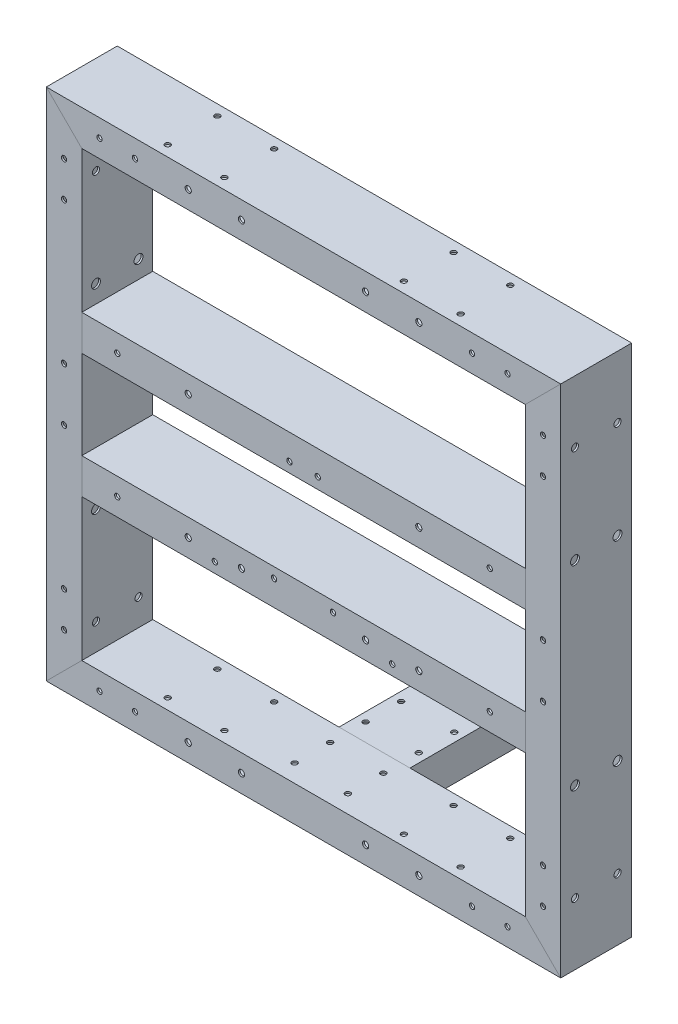
from build123d import *

# Parameters (mm, degrees)
F_20X40X1_LVGUAN20X40_1_DEPTH      = 293.360679775
F_20X40X1_LVGUAN20X40_1_DEPTH_BACK = 23.360679775
SKETCH_11_W                        = 40
SKETCH_11_H                        = 20
SKETCH_11_W_2                      = 38
SKETCH_11_H_2                      = 18
SKETCH_11_ON_SEGMENT_2_W           = 40
SKETCH_11_ON_SEGMENT_2_H           = 20
SKETCH_11_ON_SEGMENT_2_W_2         = 38
SKETCH_11_ON_SEGMENT_2_H_2         = 18
F_20X40X1_LVGUAN20X40_1_2_DEPTH    = 316.72135955
SKETCH_11_ON_SEGMENT_3_W           = 40
SKETCH_11_ON_SEGMENT_3_H           = 20
SKETCH_11_ON_SEGMENT_3_W_2         = 38
SKETCH_11_ON_SEGMENT_3_H_2         = 18
F_20X40X1_LVGUAN20X40_1_3_DEPTH    = 316.72135955
SKETCH_11_ON_SEGMENT_4_W           = 40
SKETCH_11_ON_SEGMENT_4_H           = 20
SKETCH_11_ON_SEGMENT_4_W_2         = 38
SKETCH_11_ON_SEGMENT_4_H_2         = 18
F_20X40X1_LVGUAN20X40_1_4_DEPTH    = 316.72135955
SKETCH_11_ON_SEGMENT_5_W           = 40
SKETCH_11_ON_SEGMENT_5_H           = 20
SKETCH_11_ON_SEGMENT_5_W_2         = 38
SKETCH_11_ON_SEGMENT_5_H_2         = 18
F_20X40X1_LVGUAN20X40_1_5_DEPTH    = 272
SKETCH_11_ON_SEGMENT_6_W           = 40
SKETCH_11_ON_SEGMENT_6_H           = 20
SKETCH_11_ON_SEGMENT_6_W_2         = 38
SKETCH_11_ON_SEGMENT_6_H_2         = 18
F_20X40X1_LVGUAN20X40_1_6_DEPTH    = 272
SKETCH_12_R                        = 2
CUT_EXTRUDE_1_DEPTH                = 318
SKETCH_14_R                        = 1.5
CUT_EXTRUDE_3_DEPTH                = 318
SKETCH_16_R                        = 1.5
CUT_EXTRUDE_5_DEPTH                = 50
SKETCH_113_R                       = 1.5
CUT_EXTRUDE_7_DEPTH                = 20
SKETCH_114_R                       = 1.5
CUT_EXTRUDE_8_DEPTH                = 29
SKETCH_17_R                        = 2.5
CUT_EXTRUDE_12_DEPTH               = 357
SKETCH_119_W                       = 20
SKETCH_119_H                       = 20
SKETCH_119_W_2                     = 18
SKETCH_119_H_2                     = 18
F_20X20X1_LVGUAN20X20_2_DEPTH      = 90
SKETCH_120_R                       = 1.5
CUT_EXTRUDE_13_DEPTH               = 30
SKETCH_121_R                       = 1.75
CUT_EXTRUDE_14_DEPTH               = 100
SKETCH_122_R                       = 1.75
CUT_EXTRUDE_15_DEPTH               = 40
SKETCH_123_R                       = 1.5
CUT_EXTRUDE_16_DEPTH               = 40
SKETCH_125_R                       = 1.5
CUT_EXTRUDE_18_DEPTH               = 40
SKETCH_126_R                       = 1.5
CUT_EXTRUDE_19_DEPTH               = 40
SKETCH_130_W                       = 20
SKETCH_130_H                       = 20
SKETCH_130_W_2                     = 18
SKETCH_130_H_2                     = 18
CUT_EXTRUDE_21_DEPTH               = 100
SKETCH_131_W                       = 40
SKETCH_131_H                       = 20
SKETCH_131_W_2                     = 38
SKETCH_131_H_2                     = 18
F_20X40X1_LVGUAN20X40_3_DEPTH      = 90
SKETCH_132_R                       = 1.5
CUT_EXTRUDE_22_DEPTH               = 100
SKETCH_133_R                       = 1.5
CUT_EXTRUDE_23_DEPTH               = 35
SKETCH_134_R                       = 1.75
CUT_EXTRUDE_24_DEPTH               = 82


with BuildPart() as part:
    # 草图11 → 20x40x1 LVGUAN20X40(1) (new, two sides: drawn at the far end of the back side and taken through both)
    with BuildSketch(Plane.ZX.offset(-270).offset(-F_20X40X1_LVGUAN20X40_1_DEPTH_BACK)):
        Rectangle(SKETCH_11_W, SKETCH_11_H)
        Rectangle(SKETCH_11_W_2, SKETCH_11_H_2, mode=Mode.SUBTRACT)
    extrude(amount=F_20X40X1_LVGUAN20X40_1_DEPTH + F_20X40X1_LVGUAN20X40_1_DEPTH_BACK)

    # 20x40x1 LVGUAN20X40(1) mitre 1
    split(bisect_by=Plane(origin=(0, -270, 0), x_dir=(-0.707106781, -0.707106781, 0), z_dir=(-0.707106781, 0.707106781, 0)), keep=Keep.TOP)

    # 20x40x1 LVGUAN20X40(1) mitre 2
    split(bisect_by=Plane(origin=(0, 0, 0), x_dir=(0.707106781, -0.707106781, 0), z_dir=(-0.707106781, -0.707106781, 0)), keep=Keep.TOP)


with BuildPart() as body_2:
    # 草图11 on segment 2 (carried to segment 2) → 20x40x1 LVGUAN20X40_1 2 (new body)
    with BuildSketch(Plane(origin=(-23.360679775, 0, 0), x_dir=(0, 0, 1), z_dir=(1, 0, 0))):
        Rectangle(SKETCH_11_ON_SEGMENT_2_W, SKETCH_11_ON_SEGMENT_2_H)
        Rectangle(SKETCH_11_ON_SEGMENT_2_W_2, SKETCH_11_ON_SEGMENT_2_H_2, mode=Mode.SUBTRACT)
    extrude(amount=F_20X40X1_LVGUAN20X40_1_2_DEPTH)

    # 20x40x1 LVGUAN20X40_1 2 mitre 1
    split(bisect_by=Plane(origin=(0, 0, 0), x_dir=(-0.707106781, 0.707106781, 0), z_dir=(0.707106781, 0.707106781, 0)), keep=Keep.TOP)

    # 20x40x1 LVGUAN20X40_1 2 mitre 2
    split(bisect_by=Plane(origin=(270, 0, 0), x_dir=(-0.707106781, -0.707106781, 0), z_dir=(-0.707106781, 0.707106781, 0)), keep=Keep.TOP)

    # 草图113 → 切除-拉伸7 (cut)
    with BuildSketch(Plane(origin=(0, 10, 0), x_dir=(1, 0, 0), z_dir=(0, 1, 0))):
        with Locations(Location((217.6, 14, 0), (0, 0, 270))):
            Circle(SKETCH_113_R)
        with Locations(Location((217.6, -14, 0), (0, 0, 270))):
            Circle(SKETCH_113_R)
        with Locations(Location((185.6, -14, 0), (0, 0, 270))):
            Circle(SKETCH_113_R)
        with Locations(Location((185.6, 14, 0), (0, 0, 270))):
            Circle(SKETCH_113_R)
        with Locations(Location((84.4, -14, 0), (0, 0, 270))):
            Circle(SKETCH_113_R)
        with Locations(Location((52.4, -14, 0), (0, 0, 270))):
            Circle(SKETCH_113_R)
        with Locations(Location((52.4, 14, 0), (0, 0, 270))):
            Circle(SKETCH_113_R)
        with Locations(Location((84.4, 14, 0), (0, 0, 270))):
            Circle(SKETCH_113_R)
    extrude(amount=-CUT_EXTRUDE_7_DEPTH, mode=Mode.SUBTRACT)


with BuildPart() as body_3:
    # 草图11 on segment 3 (carried to segment 3) → 20x40x1 LVGUAN20X40_1 3 (new body)
    with BuildSketch(Plane(origin=(270, 23.360679775, 0), x_dir=(0, 0, 1), z_dir=(0, -1, 0))):
        Rectangle(SKETCH_11_ON_SEGMENT_3_W, SKETCH_11_ON_SEGMENT_3_H)
        Rectangle(SKETCH_11_ON_SEGMENT_3_W_2, SKETCH_11_ON_SEGMENT_3_H_2, mode=Mode.SUBTRACT)
    extrude(amount=F_20X40X1_LVGUAN20X40_1_3_DEPTH)

    # 20x40x1 LVGUAN20X40_1 3 mitre 1
    split(bisect_by=Plane(origin=(270, 0, 0), x_dir=(0.707106781, 0.707106781, 0), z_dir=(0.707106781, -0.707106781, 0)), keep=Keep.TOP)

    # 20x40x1 LVGUAN20X40_1 3 mitre 2
    split(bisect_by=Plane(origin=(270, -270, 0), x_dir=(-0.707106781, 0.707106781, 0), z_dir=(0.707106781, 0.707106781, 0)), keep=Keep.TOP)


with BuildPart() as body_4:
    # 草图11 on segment 4 (carried to segment 4) → 20x40x1 LVGUAN20X40_1 4 (new body)
    with BuildSketch(Plane(origin=(293.360679775, -270, 0), x_dir=(0, 0, 1), z_dir=(-1, 0, 0))):
        Rectangle(SKETCH_11_ON_SEGMENT_4_W, SKETCH_11_ON_SEGMENT_4_H)
        Rectangle(SKETCH_11_ON_SEGMENT_4_W_2, SKETCH_11_ON_SEGMENT_4_H_2, mode=Mode.SUBTRACT)
    extrude(amount=F_20X40X1_LVGUAN20X40_1_4_DEPTH)

    # 20x40x1 LVGUAN20X40_1 4 mitre 1
    split(bisect_by=Plane(origin=(270, -270, 0), x_dir=(0.707106781, -0.707106781, 0), z_dir=(-0.707106781, -0.707106781, 0)), keep=Keep.TOP)

    # 20x40x1 LVGUAN20X40_1 4 mitre 2
    split(bisect_by=Plane(origin=(0, -270, 0), x_dir=(0.707106781, 0.707106781, 0), z_dir=(0.707106781, -0.707106781, 0)), keep=Keep.TOP)

    # 草图114 → 切除-拉伸8 (cut)
    with BuildSketch(Plane.XZ.offset(280)):
        with Locations(Location((185.6, -14, 0), (0, 0, 270))):
            Circle(SKETCH_114_R)
        with Locations(Location((217.6, -14, 0), (0, 0, 270))):
            Circle(SKETCH_114_R)
        with Locations(Location((217.6, 14, 0), (0, 0, 270))):
            Circle(SKETCH_114_R)
        with Locations(Location((185.6, 14, 0), (0, 0, 270))):
            Circle(SKETCH_114_R)
        with Locations(Location((52.4, 14, 0), (0, 0, 270))):
            Circle(SKETCH_114_R)
        with Locations(Location((52.4, -14, 0), (0, 0, 270))):
            Circle(SKETCH_114_R)
        with Locations(Location((84.4, -14, 0), (0, 0, 270))):
            Circle(SKETCH_114_R)
        with Locations(Location((84.4, 14, 0), (0, 0, 270))):
            Circle(SKETCH_114_R)
    extrude(amount=-CUT_EXTRUDE_8_DEPTH, mode=Mode.SUBTRACT)


with BuildPart() as body_5:
    # 草图11 on segment 5 (carried to segment 5) → 20x40x1 LVGUAN20X40_1 5 (new body)
    with BuildSketch(Plane(origin=(-1, -100, 0), x_dir=(0, 0, 1), z_dir=(1, 0, 0))):
        Rectangle(SKETCH_11_ON_SEGMENT_5_W, SKETCH_11_ON_SEGMENT_5_H)
        Rectangle(SKETCH_11_ON_SEGMENT_5_W_2, SKETCH_11_ON_SEGMENT_5_H_2, mode=Mode.SUBTRACT)
    extrude(amount=F_20X40X1_LVGUAN20X40_1_5_DEPTH)

    # 20x40x1 LVGUAN20X40_1 5 mitre 1
    split(bisect_by=Plane(origin=(10, -100, 0), x_dir=(0, 1, 0), z_dir=(1, 0, 0)), keep=Keep.TOP)

    # 20x40x1 LVGUAN20X40_1 5 mitre 2
    split(bisect_by=Plane(origin=(260, -100, 0), x_dir=(0, -1, 0), z_dir=(-1, 0, 0)), keep=Keep.TOP)

    # 草图16 → 切除-拉伸5 (cut)
    with BuildSketch(Plane.XY.offset(20)):
        with Locations(Location((127.046945119, -104.34720003, 0), (0, 0, 270))):
            Circle(SKETCH_16_R)
        with Locations(Location((143.036845279, -103.77878744, 0), (0, 0, 270))):
            Circle(SKETCH_16_R)
    extrude(amount=-CUT_EXTRUDE_5_DEPTH, mode=Mode.SUBTRACT)


with BuildPart() as body_6:
    # 草图11 on segment 6 (carried to segment 6) → 20x40x1 LVGUAN20X40_1 6 (new body)
    with BuildSketch(Plane(origin=(-1, -170, 0), x_dir=(0, 0, 1), z_dir=(1, 0, 0))):
        Rectangle(SKETCH_11_ON_SEGMENT_6_W, SKETCH_11_ON_SEGMENT_6_H)
        Rectangle(SKETCH_11_ON_SEGMENT_6_W_2, SKETCH_11_ON_SEGMENT_6_H_2, mode=Mode.SUBTRACT)
    extrude(amount=F_20X40X1_LVGUAN20X40_1_6_DEPTH)

    # 20x40x1 LVGUAN20X40_1 6 mitre 1
    split(bisect_by=Plane(origin=(10, -170, 0), x_dir=(0, 1, 0), z_dir=(1, 0, 0)), keep=Keep.TOP)

    # 20x40x1 LVGUAN20X40_1 6 mitre 2
    split(bisect_by=Plane(origin=(260, -170, 0), x_dir=(0, -1, 0), z_dir=(-1, 0, 0)), keep=Keep.TOP)

    # 草图14 → 切除-拉伸3 (cut)
    with BuildSketch(Plane.XY.offset(20)):
        with Locations((85, -174.25)):
            Circle(SKETCH_14_R)
        with Locations((185, -174.25)):
            Circle(SKETCH_14_R)
        with Locations((118.4, -165.75)):
            Circle(SKETCH_14_R)
        with Locations((151.6, -165.75)):
            Circle(SKETCH_14_R)
    extrude(amount=-CUT_EXTRUDE_3_DEPTH, mode=Mode.SUBTRACT)


with BuildPart() as cut_extrude_1_tool:
    # 草图12 → 切除-拉伸1 (new body)
    with BuildSketch(Plane.ZY.offset(10)):
        with Locations((-12, -25)):
            Circle(SKETCH_12_R)
        with Locations((12, -25)):
            Circle(SKETCH_12_R)
        with Locations((-12, -245)):
            Circle(SKETCH_12_R)
        with Locations((12, -245)):
            Circle(SKETCH_12_R)
    extrude(amount=-CUT_EXTRUDE_1_DEPTH)


with BuildPart() as part_1:
    add(part.part)

    # 切除-拉伸1: cut by cut_extrude_1_tool
    add(cut_extrude_1_tool.part, mode=Mode.SUBTRACT)


with BuildPart() as body_3_1:
    add(body_3.part)

    # 切除-拉伸1: cut by cut_extrude_1_tool
    add(cut_extrude_1_tool.part, mode=Mode.SUBTRACT)


with BuildPart() as cut_extrude_12_tool:
    # 草图17 → 切除-拉伸12 (new body)
    with BuildSketch(Plane(origin=(280, 0, 0), x_dir=(0, 0, -1), z_dir=(1, 0, 0))):
        with Locations((-12, -80)):
            Circle(SKETCH_17_R)
        with Locations((12, -80)):
            Circle(SKETCH_17_R)
        with Locations((-12, -190)):
            Circle(SKETCH_17_R)
        with Locations((12, -190)):
            Circle(SKETCH_17_R)
    extrude(amount=-CUT_EXTRUDE_12_DEPTH)


with BuildPart() as part_2:
    add(part_1.part)

    # 切除-拉伸12: cut by cut_extrude_12_tool
    add(cut_extrude_12_tool.part, mode=Mode.SUBTRACT)


with BuildPart() as body_3_2:
    add(body_3_1.part)

    # 切除-拉伸12: cut by cut_extrude_12_tool
    add(cut_extrude_12_tool.part, mode=Mode.SUBTRACT)


with BuildPart() as body_7:
    # 草图119 → 20x20x1 LVGUAN20X20(2) (new body)
    with BuildSketch(Plane(origin=(135, -270, -20), x_dir=(1, 0, 0), z_dir=(0, 0, -1))):
        Rectangle(SKETCH_119_W, SKETCH_119_H)
        Rectangle(SKETCH_119_W_2, SKETCH_119_H_2, mode=Mode.SUBTRACT)
    extrude(amount=F_20X20X1_LVGUAN20X20_2_DEPTH)

    # 草图120 → 切除-拉伸13 (cut)
    with BuildSketch(Plane(origin=(0, -260, 0), x_dir=(1, 0, 0), z_dir=(0, 1, 0))):
        with Locations(Location((129, 105, 0), (0, 0, 270))):
            Circle(SKETCH_120_R)
        with Locations(Location((141, 105, 0), (0, 0, 270))):
            Circle(SKETCH_120_R)
        with Locations(Location((141, 85, 0), (0, 0, 270))):
            Circle(SKETCH_120_R)
        with Locations(Location((129, 85, 0), (0, 0, 270))):
            Circle(SKETCH_120_R)
    extrude(amount=-CUT_EXTRUDE_13_DEPTH, mode=Mode.SUBTRACT)

    # 草图130 → 切除-拉伸21 (cut)
    with BuildSketch(Plane(origin=(0, 0, -20), x_dir=(-1, 0, 0), z_dir=(0, 0, -1))):
        with Locations((-135, -270)):
            Rectangle(SKETCH_130_W, SKETCH_130_H)
        with Locations((-135, -270)):
            Rectangle(SKETCH_130_W_2, SKETCH_130_H_2, mode=Mode.SUBTRACT)
    extrude(amount=CUT_EXTRUDE_21_DEPTH, mode=Mode.SUBTRACT)


with BuildPart() as cut_extrude_14_tool:
    # 草图121 → 切除-拉伸14 (new body)
    with BuildSketch(Plane.XY.offset(20)):
        with Locations((170, -270)):
            Circle(SKETCH_121_R)
        with Locations((100, -270)):
            Circle(SKETCH_121_R)
        with Locations((100, -170)):
            Circle(SKETCH_121_R)
        with Locations((170, -170)):
            Circle(SKETCH_121_R)
        with Locations((200, -170)):
            Circle(SKETCH_121_R)
        with Locations((70, -170)):
            Circle(SKETCH_121_R)
        with Locations((70, -270)):
            Circle(SKETCH_121_R)
        with Locations((200, -270)):
            Circle(SKETCH_121_R)
    extrude(amount=-CUT_EXTRUDE_14_DEPTH)


with BuildPart() as body_4_1:
    add(body_4.part)

    # 切除-拉伸14: cut by cut_extrude_14_tool
    add(cut_extrude_14_tool.part, mode=Mode.SUBTRACT)


with BuildPart() as body_6_1:
    add(body_6.part)

    # 切除-拉伸14: cut by cut_extrude_14_tool
    add(cut_extrude_14_tool.part, mode=Mode.SUBTRACT)


with BuildPart() as cut_extrude_15_tool:
    # 草图122 → 切除-拉伸15 (new body)
    with BuildSketch(Plane(origin=(0, 0, -20), x_dir=(-1, 0, 0), z_dir=(0, 0, -1))):
        with Locations(Location((-200, -100, 0), (0, 0, 90))):
            Circle(SKETCH_122_R)
        with Locations(Location((-70, -100, 0), (0, 0, 90))):
            Circle(SKETCH_122_R)
        with Locations(Location((-70, 0, 0), (0, 0, 90))):
            Circle(SKETCH_122_R)
        with Locations(Location((-200, 0, 0), (0, 0, 90))):
            Circle(SKETCH_122_R)
    extrude(amount=-CUT_EXTRUDE_15_DEPTH)


with BuildPart() as body_2_1:
    add(body_2.part)

    # 切除-拉伸15: cut by cut_extrude_15_tool
    add(cut_extrude_15_tool.part, mode=Mode.SUBTRACT)


with BuildPart() as body_5_1:
    add(body_5.part)

    # 切除-拉伸15: cut by cut_extrude_15_tool
    add(cut_extrude_15_tool.part, mode=Mode.SUBTRACT)


with BuildPart() as cut_extrude_16_tool:
    # 草图123 → 切除-拉伸16 (new body)
    with BuildSketch(Plane(origin=(0, 0, -20), x_dir=(-1, 0, 0), z_dir=(0, 0, -1))):
        with Locations(Location((-240, -100, 0), (0, 0, 90))):
            Circle(SKETCH_123_R)
        with Locations(Location((-240, -170, 0), (0, 0, 90))):
            Circle(SKETCH_123_R)
        with Locations(Location((-30, -100, 0), (0, 0, 90))):
            Circle(SKETCH_123_R)
        with Locations(Location((-30, -170, 0), (0, 0, 90))):
            Circle(SKETCH_123_R)
    extrude(amount=-CUT_EXTRUDE_16_DEPTH)


with BuildPart() as body_5_2:
    add(body_5_1.part)

    # 切除-拉伸16: cut by cut_extrude_16_tool
    add(cut_extrude_16_tool.part, mode=Mode.SUBTRACT)


with BuildPart() as body_6_2:
    add(body_6_1.part)

    # 切除-拉伸16: cut by cut_extrude_16_tool
    add(cut_extrude_16_tool.part, mode=Mode.SUBTRACT)


with BuildPart() as cut_extrude_18_tool:
    # 草图125 → 切除-拉伸18 (new body)
    with BuildSketch(Plane(origin=(0, 0, -20), x_dir=(-1, 0, 0), z_dir=(0, 0, -1))):
        with Locations(Location((-40, -270, 0), (0, 0, 90))):
            Circle(SKETCH_125_R)
        with Locations(Location((-20, -270, 0), (0, 0, 90))):
            Circle(SKETCH_125_R)
        with Locations(Location((0, -230, 0), (0, 0, 90))):
            Circle(SKETCH_125_R)
        with Locations(Location((0, -250, 0), (0, 0, 90))):
            Circle(SKETCH_125_R)
        with Locations(Location((-270, -230, 0), (0, 0, 90))):
            Circle(SKETCH_125_R)
        with Locations(Location((-270, -250, 0), (0, 0, 90))):
            Circle(SKETCH_125_R)
        with Locations(Location((-230, -270, 0), (0, 0, 90))):
            Circle(SKETCH_125_R)
        with Locations(Location((-250, -270, 0), (0, 0, 90))):
            Circle(SKETCH_125_R)
        with Locations(Location((0, -40, 0), (0, 0, 90))):
            Circle(SKETCH_125_R)
        with Locations(Location((0, -20, 0), (0, 0, 90))):
            Circle(SKETCH_125_R)
        with Locations(Location((-40, 0, 0), (0, 0, 90))):
            Circle(SKETCH_125_R)
        with Locations(Location((-20, 0, 0), (0, 0, 90))):
            Circle(SKETCH_125_R)
        with Locations(Location((-230, 0, 0), (0, 0, 90))):
            Circle(SKETCH_125_R)
        with Locations(Location((-250, 0, 0), (0, 0, 90))):
            Circle(SKETCH_125_R)
        with Locations(Location((-270, -40, 0), (0, 0, 90))):
            Circle(SKETCH_125_R)
        with Locations(Location((-270, -20, 0), (0, 0, 90))):
            Circle(SKETCH_125_R)
    extrude(amount=-CUT_EXTRUDE_18_DEPTH)


with BuildPart() as part_3:
    add(part_2.part)

    # 切除-拉伸18: cut by cut_extrude_18_tool
    add(cut_extrude_18_tool.part, mode=Mode.SUBTRACT)


with BuildPart() as body_2_2:
    add(body_2_1.part)

    # 切除-拉伸18: cut by cut_extrude_18_tool
    add(cut_extrude_18_tool.part, mode=Mode.SUBTRACT)

    # 草图134 → 切除-拉伸24 (cut)
    with BuildSketch(Plane.XY.offset(20)):
        with Locations((170, -270)):
            Circle(SKETCH_134_R)
        with Locations((100, -270)):
            Circle(SKETCH_134_R)
        with Locations(Location((100, 0, 0), (0, 0, 270))):
            Circle(SKETCH_134_R)
        with Locations(Location((170, 0, 0), (0, 0, 270))):
            Circle(SKETCH_134_R)
    extrude(amount=-CUT_EXTRUDE_24_DEPTH, mode=Mode.SUBTRACT)


with BuildPart() as body_3_3:
    add(body_3_2.part)

    # 切除-拉伸18: cut by cut_extrude_18_tool
    add(cut_extrude_18_tool.part, mode=Mode.SUBTRACT)


with BuildPart() as body_4_2:
    add(body_4_1.part)

    # 切除-拉伸18: cut by cut_extrude_18_tool
    add(cut_extrude_18_tool.part, mode=Mode.SUBTRACT)


with BuildPart() as cut_extrude_19_tool:
    # 草图126 → 切除-拉伸19 (new body)
    with BuildSketch(Plane(origin=(0, 0, -20), x_dir=(-1, 0, 0), z_dir=(0, 0, -1))):
        with Locations((0, -120)):
            Circle(SKETCH_126_R)
        with Locations(Location((0, -150, 0), (0, 0, 180))):
            Circle(SKETCH_126_R)
        with Locations((-270, -150)):
            Circle(SKETCH_126_R)
        with Locations(Location((-270, -120, 0), (0, 0, 180))):
            Circle(SKETCH_126_R)
    extrude(amount=-CUT_EXTRUDE_19_DEPTH)


with BuildPart() as part_4:
    add(part_3.part)

    # 切除-拉伸19: cut by cut_extrude_19_tool
    add(cut_extrude_19_tool.part, mode=Mode.SUBTRACT)


with BuildPart() as body_3_4:
    add(body_3_3.part)

    # 切除-拉伸19: cut by cut_extrude_19_tool
    add(cut_extrude_19_tool.part, mode=Mode.SUBTRACT)


with BuildPart() as body_7_2:
    # 草图131 → 20x40x1 LVGUAN20X40(3) (new body)
    with BuildSketch(Plane(origin=(135, -270, -20), x_dir=(1, 0, 0), z_dir=(0, 0, -1))):
        Rectangle(SKETCH_131_W, SKETCH_131_H)
        Rectangle(SKETCH_131_W_2, SKETCH_131_H_2, mode=Mode.SUBTRACT)
    extrude(amount=F_20X40X1_LVGUAN20X40_3_DEPTH)

    # 草图132 → 切除-拉伸22 (cut)
    with BuildSketch(Plane.XZ.offset(280)):
        with Locations(Location((119, -87.5, 0), (0, 0, 270))):
            Circle(SKETCH_132_R)
        with Locations(Location((151, -87.5, 0), (0, 0, 270))):
            Circle(SKETCH_132_R)
        with Locations(Location((151, -102.5, 0), (0, 0, 270))):
            Circle(SKETCH_132_R)
        with Locations(Location((119, -102.5, 0), (0, 0, 270))):
            Circle(SKETCH_132_R)
    extrude(amount=-CUT_EXTRUDE_22_DEPTH, mode=Mode.SUBTRACT)


with BuildPart() as cut_extrude_23_tool:
    # 草图133 → 切除-拉伸23 (new body)
    with BuildSketch(Plane.XZ.offset(280)):
        with Locations(Location((120, -30, 0), (0, 0, 270))):
            Circle(SKETCH_133_R)
        with Locations(Location((150, -30, 0), (0, 0, 270))):
            Circle(SKETCH_133_R)
        with Locations(Location((150, -50, 0), (0, 0, 270))):
            Circle(SKETCH_133_R)
        with Locations(Location((120, -50, 0), (0, 0, 270))):
            Circle(SKETCH_133_R)
        with Locations(Location((120, 10, 0), (0, 0, 90))):
            Circle(SKETCH_133_R)
        with Locations(Location((150, 10, 0), (0, 0, 90))):
            Circle(SKETCH_133_R)
        with Locations(Location((150, -10, 0), (0, 0, 90))):
            Circle(SKETCH_133_R)
        with Locations(Location((120, -10, 0), (0, 0, 90))):
            Circle(SKETCH_133_R)
    extrude(amount=-CUT_EXTRUDE_23_DEPTH)


with BuildPart() as body_4_3:
    add(body_4_2.part)

    # 切除-拉伸23: cut by cut_extrude_23_tool
    add(cut_extrude_23_tool.part, mode=Mode.SUBTRACT)


with BuildPart() as body_7_2_1:
    add(body_7_2.part)

    # 切除-拉伸23: cut by cut_extrude_23_tool
    add(cut_extrude_23_tool.part, mode=Mode.SUBTRACT)


solid = Compound([body_5_2.part, body_6_2.part, body_2_2.part, part_4.part, body_3_4.part, body_4_3.part, body_7_2_1.part])
